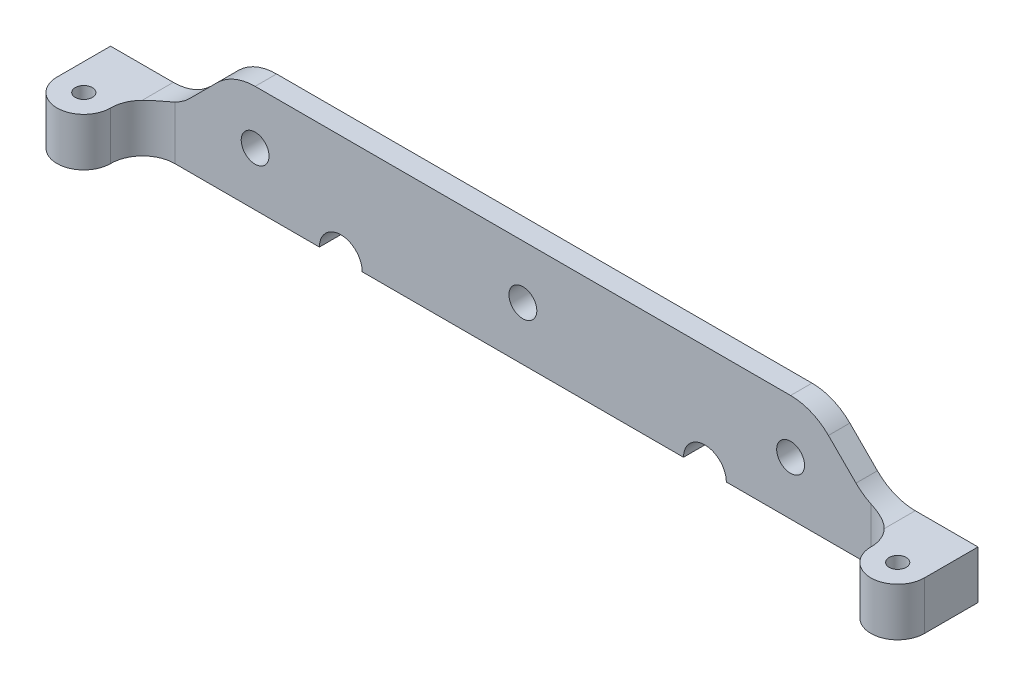
from build123d import *
from build123d.topology import SkipClean

# Parameters (mm, degrees)
SKETCH1_R           = 1.6
BOSS_EXTRUDE1_DEPTH = 20
SKETCH3_R           = 2.6
BOSS_EXTRUDE2_DEPTH = 15


with BuildPart() as part:
    # Sketch1 → Boss-Extrude1 (new body)
    with BuildSketch(Plane(origin=(0, 0, 0), x_dir=(1, 0, 0), z_dir=(0, 1, 0))):
        with BuildLine():
            Line((165, -10), (165, 0))
            Line((165, 0), (84, 0))
            Line((84, 0), (84, -4))
            Line((84, -4), (149, -4))
            ThreePointArc((149, -4), (153.242640687, -5.757359313), (155, -10))
            ThreePointArc((155, -10), (160, -15), (165, -10))
        make_face()
        with Locations(Location((160, -10, 0), (0, 0, 270))):
            Circle(SKETCH1_R, mode=Mode.SUBTRACT)
    extrude(amount=BOSS_EXTRUDE1_DEPTH)


with BuildPart() as body_2:
    # Sketch3 → Boss-Extrude2 (new, through all)
    with BuildSketch(Plane.XY):
        with BuildLine():
            Line((122, 0), (165, 0))
            Line((165, 0), (165, 9))
            Line((165, 9), (153.284271247, 9))
            ThreePointArc((153.284271247, 9), (149.457436924, 9.761204675), (146.213203436, 11.928932188))
            Line((146.213203436, 11.928932188), (141.071067812, 17.071067812))
            ThreePointArc((141.071067812, 17.071067812), (137.826834324, 19.238795325), (134, 20))
            Line((134, 20), (84, 20))
            Line((84, 20), (84, 12.6))
            ThreePointArc((84, 12.6), (85.838477631, 11.838477631), (86.6, 10))
            ThreePointArc((86.6, 10), (85.838477631, 8.161522369), (84, 7.4))
            Line((84, 7.4), (84, 0))
            Line((84, 0), (114, 0))
            ThreePointArc((114, 0), (118, 4), (122, 0))
        make_face()
        with Locations((134, 10)):
            Circle(SKETCH3_R, mode=Mode.SUBTRACT)
    extrude(amount=BOSS_EXTRUDE2_DEPTH)

    # Intersect1: read off the stored shape, not the designer's step
    # Intersect1: intersect part
    add(part.part, mode=Mode.INTERSECT)

    # Mirror1: body 2 across face


with BuildPart() as body_2_1:
    with SkipClean():  # the faces are left unmerged after this step: merging them gives an invalid solid
        add(body_2.part)
        add(body_2.part.mirror(Plane(origin=(84, 16.3, 2), x_dir=(0, 0, 1), z_dir=(-1, 0, 0))))


solid = body_2_1.part
